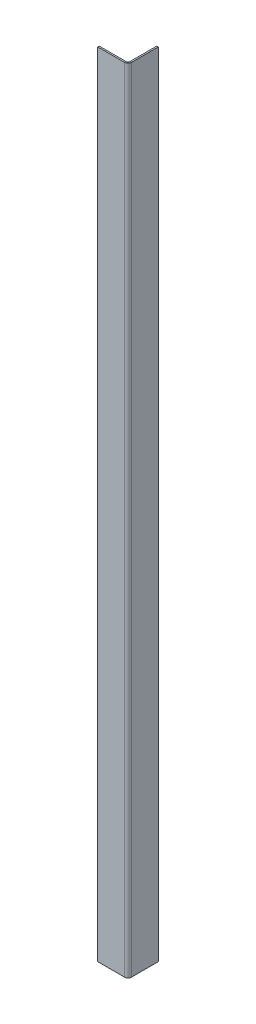
from build123d import *

# Parameters (mm, degrees)
SKETCH1_W                    = 40
SKETCH1_H                    = 1045
BASE_FLANGE1_DEPTH           = 2
EDGE_FLANGE1_STRIP_W         = 13
EDGE_FLANGE1_STRIP_H         = 2
EDGE_FLANGE1_STRIP_CUT_DEPTH = 1045
EDGE_FLANGE1_DEPTH           = 1045


# Sheet-metal steps are written as plain solids
with BuildPart() as part:
    # Sketch1 → Base-Flange1 (new body)
    with BuildSketch(Plane(origin=(0, 0, 0), x_dir=(0, 0, -1), z_dir=(1, 0, 0))):
        Rectangle(SKETCH1_W, SKETCH1_H)
    extrude(amount=-BASE_FLANGE1_DEPTH)

    # Edge-Flange1 strip (across the edge) → Edge-Flange1 strip cut (cut)
    with BuildSketch(Plane(origin=(-2, -522.5, 20), x_dir=(0, 0, -1), z_dir=(0, 1, 0))):
        with Locations((-2, -1)):
            Rectangle(EDGE_FLANGE1_STRIP_W, EDGE_FLANGE1_STRIP_H)
    extrude(amount=EDGE_FLANGE1_STRIP_CUT_DEPTH, mode=Mode.SUBTRACT)

    # Edge-Flange1 section (across the edge) → Edge-Flange1 (add)
    with BuildSketch(Plane(origin=(-2, -522.5, 20), x_dir=(0, 0, -1), z_dir=(0, 1, 0))):
        with BuildLine():
            Line((0, 2.5), (0, 38))
            Line((0, 38), (2, 38))
            Line((2, 38), (2, 2.5))
            ThreePointArc((2, 2.5), (2.732233047, 0.732233047), (4.5, 0))
            Line((4.5, 0), (4.5, -2))
            ThreePointArc((4.5, -2), (1.318019485, -0.681980515), (0, 2.5))
        make_face()
    extrude(amount=EDGE_FLANGE1_DEPTH)


solid = part.part
